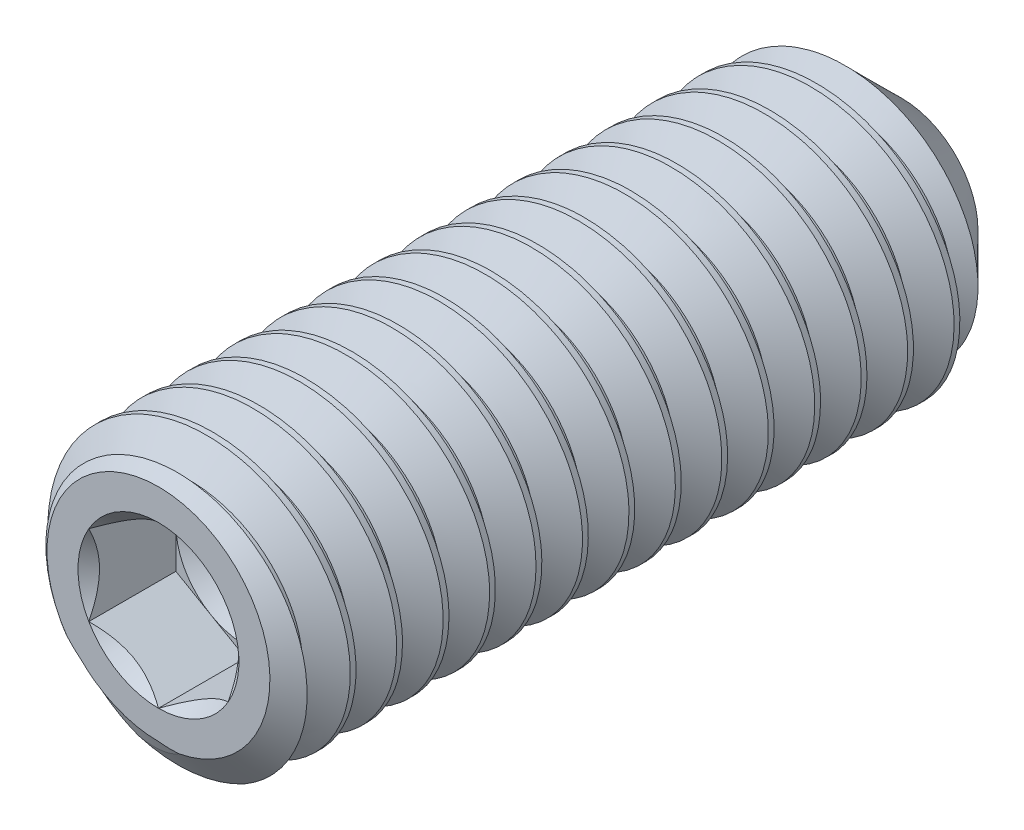
from build123d import *

# Parameters (mm, degrees)
CUT_SWEEP2_PITCH    = 1
CUT_EXTRUDE10_DEPTH = 1.875


with BuildPart() as part:
    # Sketch22 → Revolve1 (revolve)
    with BuildSketch(Plane(origin=(0, 0, 0), x_dir=(0, 0, -1), z_dir=(1, 0, 0)), mode=Mode.PRIVATE) as revolve1_sk:
        Polygon((-7.506124201, 0), (-7.506124201, 2.4), (-7.085999678, 3), (7.137770518, 3), (8.493875799, 1.643894719), (7.506124201, 0), align=None)
    revolve(revolve1_sk.sketch.rotate(Axis((0, 0, -7.506124201), (0, 0, -1)), 180), axis=Axis((0, 0, -7.506124201), (0, 0, -1)))

    # Cut-Sweep2: the profile of Sketch28 profile screwed along a right-hand helix of 17 turns, 8 arcs to a turn; built about Z, then put on its axis
    cut_sweep2_z = Axis((0, 0, 0), (0, 0, 1))
    cut_sweep2_corners = [(3.0003, 0, 0.000173205), (3.0003, 0, -0.875173205), (2.350480947, 0, -0.5), (2.350480947, 0, -0.375)]
    with BuildLine(mode=Mode.PRIVATE) as cut_sweep2_profile:
        Line(cut_sweep2_corners[0], cut_sweep2_corners[1])
        Line(cut_sweep2_corners[1], cut_sweep2_corners[2])
        Line(cut_sweep2_corners[2], cut_sweep2_corners[3])
        Line(cut_sweep2_corners[3], cut_sweep2_corners[0])
    cut_sweep2_cap = Face(cut_sweep2_profile.wire())
    cut_sweep2_turn_angles = [0, 22.5, 45, 67.5, 90, 112.5, 135, 157.5, 180, 202.5, 225, 247.5, 270, 292.5, 315, 337.5, 360]
    cut_sweep2_turn_weights = [1, 0.9238795325112867, 1, 0.9238795325112867, 1, 0.9238795325112867, 1, 0.9238795325112867, 1, 0.9238795325112867, 1, 0.9238795325112867, 1, 0.9238795325112867, 1, 0.9238795325112867, 1]
    cut_sweep2_turn_rails = [Edge.make_bspline([Vector(p[0], p[1], 0).rotate(cut_sweep2_z, cut_sweep2_turn_angles[k]) / cut_sweep2_turn_weights[k] + Vector(0, 0, p[2] + CUT_SWEEP2_PITCH * cut_sweep2_turn_angles[k] / 360) for k in range(17)], [0, 0, 0, 1, 1, 2, 2, 3, 3, 4, 4, 5, 5, 6, 6, 7, 7, 8, 8, 8], 2, cut_sweep2_turn_weights) for p in cut_sweep2_corners]
    cut_sweep2_turn_sides = [Face.make_surface_from_curves(cut_sweep2_turn_rails[p[0]], cut_sweep2_turn_rails[p[1]]) for p in [(0, 1), (1, 2), (2, 3), (3, 0)]]
    cut_sweep2 = Plane(origin=(0, 0, -8.493875799), x_dir=(0, 1, 0), z_dir=(0, 0, 1)) * Solid(Shell([*[p.moved(Location((0, 0, CUT_SWEEP2_PITCH * i))) for i in range(17) for p in cut_sweep2_turn_sides], cut_sweep2_cap, cut_sweep2_cap.rotate(cut_sweep2_z, 6120).moved(Location((0, 0, CUT_SWEEP2_PITCH * 6120 / 360)))]))
    add(cut_sweep2, mode=Mode.SUBTRACT)

    # Sketch23 → Cut-Extrude10 (cut)
    with BuildSketch(Plane.XY.offset(7.506124201)):
        Polygon((0, 1.732050808), (-1.5, 0.866025404), (-1.5, -0.866025404), (0, -1.732050808), (1.5, -0.866025404), (1.5, 0.866025404), align=None)
    extrude(amount=-CUT_EXTRUDE10_DEPTH, mode=Mode.SUBTRACT)

    # Cut-Extrude11 cone 1 section (through the dimple's axis) → Cut-Extrude11 (revolve, cut)
    with BuildSketch(Plane(origin=(0, 0, 7.506124201), x_dir=(0, -1, 0), z_dir=(1, 0, 0))):
        Polygon((0, 0), (1.732050808, 0), (0, 1.732050808), align=None)
    revolve(axis=Axis((0, 0, 7.506124201), (0, 0, -1)), mode=Mode.SUBTRACT)

    # Cut-Extrude12 cone 1 section (through the dimple's axis) → Cut-Extrude12 (revolve, cut)
    with BuildSketch(Plane(origin=(0, 0, 5.631124201), x_dir=(0, -1, 0), z_dir=(1, 0, 0))):
        Polygon((0, 0), (1.5, 0), (0, 0.866025404), align=None)
    revolve(axis=Axis((0, 0, 5.631124201), (0, 0, -1)), mode=Mode.SUBTRACT)


solid = part.part
